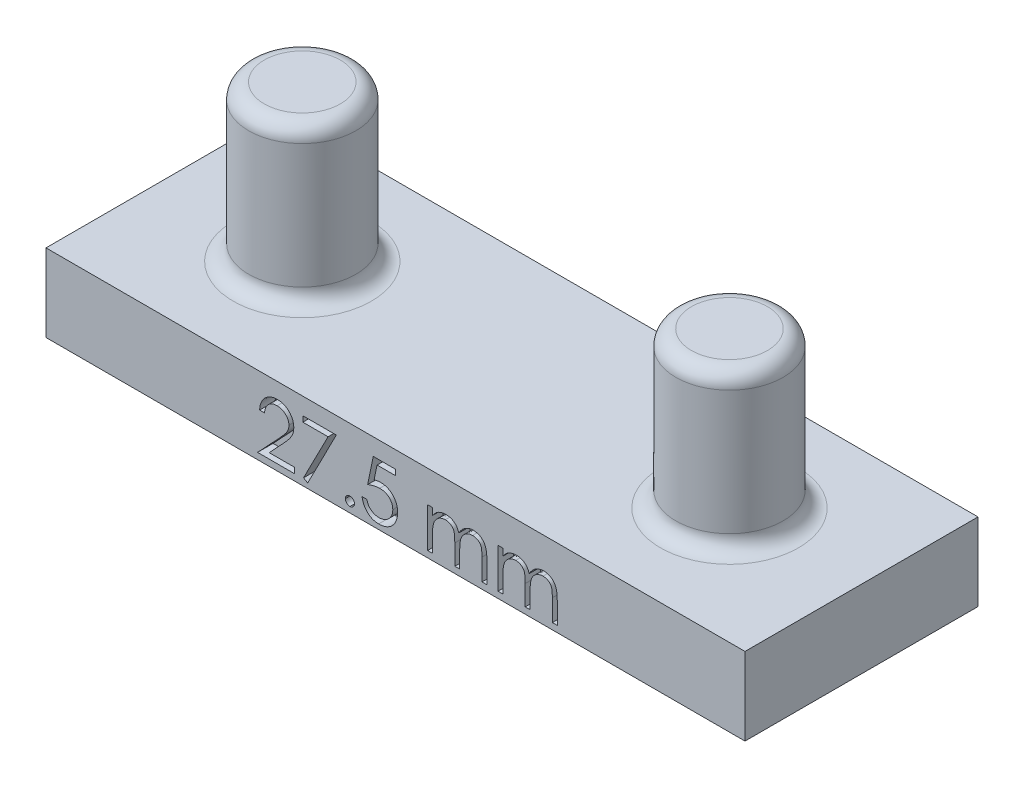
from build123d import *

# Parameters (mm, degrees)
SKETCH1_R             = 3.448679322
BOSS_EXTRUDE1_DEPTH   = 10
BOSS_EXTRUDE1_2_DEPTH = 10
SKETCH2_W             = 45
SKETCH2_H             = 15
BOSS_EXTRUDE2_DEPTH   = 5
CUT_EXTRUDE1_DEPTH    = 1
FILLET1_R             = 1


with BuildPart() as part:
    # Sketch1 → Boss-Extrude1 (new body)
    with BuildSketch(Plane(origin=(0, 0, 0), x_dir=(1, 0, 0), z_dir=(0, 1, 0))):
        with Locations((-41.821276596, 3.10212766)):
            Circle(SKETCH1_R)
    extrude(amount=BOSS_EXTRUDE1_DEPTH)



with BuildPart() as body_2:
    # Sketch1 → Boss-Extrude1 2 (new body)
    with BuildSketch(Plane(origin=(0, 0, 0), x_dir=(1, 0, 0), z_dir=(0, 1, 0))):
        with Locations((-14.321276596, 3.10212766)):
            Circle(SKETCH1_R)
    extrude(amount=BOSS_EXTRUDE1_2_DEPTH)


with BuildPart() as part_1:
    add(part.part)

    add(body_2.part)  # Boss-Extrude2 merges body 2
    # Sketch2 → Boss-Extrude2 (add)
    with BuildSketch(Plane.XZ):
        with Locations((-28.321276596, -3.10212766)):
            Rectangle(SKETCH2_W, SKETCH2_H)
    extrude(amount=BOSS_EXTRUDE2_DEPTH)

    # Sketch3 → Cut-Extrude1 (cut)
    with BuildSketch(Plane.XY.offset(4.39787234)):
        with BuildLine():
            Line((-21.721415096, -2.034062219), (-21.407312532, -2.034062219))
            Line((-21.407312532, -2.034062219), (-21.407312532, -2.478573436))
            add(Edge.make_bspline(
                [(-21.407312532, -2.478573436), (-21.379028582, -2.439685835), (-21.324833822, -2.365173462), (-21.23596817, -2.266983177), (-21.147192057, -2.183655023), (-21.083258676, -2.139912151), (-21.052544904, -2.118897956)],
                knots=[0, 0, 0, 0, 1.134379233, 2.173579362, 3.122582517, 4, 4, 4, 4], degree=3))
            add(Edge.make_bspline(
                [(-21.052544904, -2.118897956), (-21.010680241, -2.09889259), (-20.927682342, -2.059231377), (-20.796263117, -2.018997818), (-20.661788447, -1.994272717), (-20.570980233, -1.990891343), (-20.525301314, -1.989190424)],
                knots=[0, 0, 0, 0, 1.014936303, 2.012140481, 3.000054389, 4, 4, 4, 4], degree=3))
            add(Edge.make_bspline(
                [(-20.525301314, -1.989190424), (-20.494408317, -1.990235714), (-20.433272738, -1.992304289), (-20.342688648, -2.005764324), (-20.254830036, -2.029030497), (-20.170216007, -2.061437821), (-20.090495328, -2.100684508), (-20.01740613, -2.146734216), (-19.951781922, -2.198431291), (-19.893655871, -2.258110224), (-19.841386845, -2.327446823), (-19.793307998, -2.408311072), (-19.748882786, -2.502518733), (-19.724261477, -2.570885274), (-19.71129891, -2.606878725)],
                knots=[0, 0, 0, 0, 1.009824226, 1.998387844, 2.986035974, 3.974953746, 4.955485308, 5.885931332, 6.793869504, 7.679848016, 8.601185859, 9.625726857, 10.749998409, 12, 12, 12, 12], degree=3))
            add(Edge.make_bspline(
                [(-19.71129891, -2.606878725), (-19.697587659, -2.582154306), (-19.670605842, -2.533500121), (-19.625300205, -2.464641858), (-19.577832408, -2.400235067), (-19.527797915, -2.340228642), (-19.475373328, -2.284918912), (-19.420311928, -2.23412301), (-19.362927146, -2.187622797), (-19.283134906, -2.133299637), (-19.179322299, -2.075598456), (-19.048434184, -2.025570012), (-18.912284013, -1.994653883), (-18.819866315, -1.99102361), (-18.773197949, -1.989190424)],
                knots=[0, 0, 0, 0, 0.86119277, 1.694706429, 2.50939023, 3.298075842, 4.073795165, 4.829715201, 5.57930267, 6.321991688, 7.768977793, 9.186738141, 10.579381044, 12, 12, 12, 12], degree=3))
            add(Edge.make_bspline(
                [(-18.773197949, -1.989190424), (-18.730316486, -1.990807645), (-18.646393299, -1.993972703), (-18.524216034, -2.018826176), (-18.410274228, -2.061503823), (-18.304797152, -2.11973746), (-18.209637339, -2.192916643), (-18.12692103, -2.279985481), (-18.057150666, -2.380328104), (-18.011572027, -2.474720092), (-17.980656762, -2.558055425), (-17.961595528, -2.629061717), (-17.944755833, -2.707213269), (-17.930774588, -2.792603531), (-17.920556036, -2.885534139), (-17.91298532, -2.985853015), (-17.907861247, -3.093638127), (-17.907499174, -3.168003627), (-17.907312532, -3.20633786)],
                knots=[0, 0, 0, 0, 1.209669288, 2.367440248, 3.500751976, 4.631527125, 5.755587489, 6.87532382, 8.007944318, 9.190864318, 9.82315674, 10.514484317, 11.263564316, 12.079023757, 12.955305781, 13.901327259, 14.918167583, 16, 16, 16, 16], degree=3))
            Line((-17.907312532, -3.20633786), (-17.907312532, -4.591754526))
            Line((-17.907312532, -4.591754526), (-18.221415096, -4.591754526))
            Line((-18.221415096, -4.591754526), (-18.221415096, -3.204935616))
            add(Edge.make_bspline(
                [(-18.221415096, -3.204935616), (-18.221492979, -3.172215042), (-18.221642658, -3.109331075), (-18.22433629, -3.019078624), (-18.229411604, -2.936810267), (-18.235346243, -2.862638179), (-18.243590052, -2.79638939), (-18.254235984, -2.738196972), (-18.265513664, -2.68760316), (-18.284249655, -2.631517113), (-18.314197546, -2.569646902), (-18.359815026, -2.502923326), (-18.417285133, -2.444842526), (-18.483645289, -2.394424209), (-18.559193734, -2.353430568), (-18.642458457, -2.324154558), (-18.732922509, -2.30603168), (-18.795545297, -2.304225665), (-18.827885449, -2.303292988)],
                knots=[0, 0, 0, 0, 1.253487763, 2.409012846, 3.458416907, 4.410876679, 5.259312806, 6.014470957, 6.676830364, 7.243083969, 8.276244668, 9.299465089, 10.325150304, 11.392391894, 12.482080715, 13.603491619, 14.762376348, 16, 16, 16, 16], degree=3))
            add(Edge.make_bspline(
                [(-18.827885449, -2.303292988), (-18.867555403, -2.304709145), (-18.945958314, -2.307508011), (-19.0604038, -2.336081884), (-19.170374817, -2.379162134), (-19.27258995, -2.441594591), (-19.36661774, -2.516402955), (-19.447517318, -2.605352551), (-19.514349504, -2.705982478), (-19.55960348, -2.79912918), (-19.588192781, -2.882798624), (-19.607069697, -2.955895996), (-19.621753088, -3.038977564), (-19.635523617, -3.131485055), (-19.644511345, -3.234055235), (-19.652679718, -3.346213636), (-19.656500581, -3.468297596), (-19.657035039, -3.552924284), (-19.657312532, -3.596862699)],
                knots=[0, 0, 0, 0, 1.090531906, 2.155305635, 3.229839962, 4.33261226, 5.44038871, 6.529323825, 7.629011124, 8.757537029, 9.370236727, 10.061839251, 10.834451254, 11.692844982, 12.636905849, 13.66920014, 14.789842145, 16, 16, 16, 16], degree=3))
            Line((-19.657312532, -3.596862699), (-19.657312532, -4.591754526))
            Line((-19.657312532, -4.591754526), (-19.971415096, -4.591754526))
            Line((-19.971415096, -4.591754526), (-19.971415096, -3.291173597))
            add(Edge.make_bspline(
                [(-19.971415096, -3.291173597), (-19.971494527, -3.254480278), (-19.971647344, -3.183886021), (-19.974323661, -3.082652345), (-19.979410283, -2.990571265), (-19.985290832, -2.907749802), (-19.99375101, -2.834338473), (-20.003360772, -2.769943715), (-20.014709383, -2.714726964), (-20.033499267, -2.654163579), (-20.062213736, -2.587442656), (-20.108401998, -2.516301635), (-20.166009578, -2.454033537), (-20.233580454, -2.400874789), (-20.309586136, -2.356933307), (-20.393569537, -2.325273556), (-20.48477445, -2.306849266), (-20.547652156, -2.304500769), (-20.579988814, -2.303292988)],
                knots=[0, 0, 0, 0, 1.320475261, 2.540461679, 3.643808994, 4.639130445, 5.527981419, 6.302341397, 6.981980563, 7.553956391, 8.582137848, 9.585246428, 10.591171744, 11.620968678, 12.668337649, 13.738356861, 14.836885341, 16, 16, 16, 16], degree=3))
            add(Edge.make_bspline(
                [(-20.579988814, -2.303292988), (-20.618005025, -2.304823448), (-20.693769985, -2.3078736), (-20.805071954, -2.335327874), (-20.912557638, -2.378331949), (-21.014512337, -2.437991768), (-21.108186485, -2.511890847), (-21.190194752, -2.598805742), (-21.259137278, -2.697654776), (-21.304869093, -2.789819292), (-21.334367567, -2.871392567), (-21.353962902, -2.940743515), (-21.370802527, -3.017743763), (-21.383316549, -3.102630874), (-21.395396965, -3.194851968), (-21.401227274, -3.294866458), (-21.406898836, -3.402588546), (-21.407171251, -3.476961091), (-21.407312532, -3.515532571)],
                knots=[0, 0, 0, 0, 1.098833095, 2.189935336, 3.297829714, 4.440610912, 5.596351641, 6.740013378, 7.886572111, 9.072425424, 9.705826452, 10.395263256, 11.156850408, 11.985370555, 12.878090359, 13.847760091, 14.883794034, 16, 16, 16, 16], degree=3))
            Line((-21.407312532, -3.515532571), (-21.407312532, -4.591754526))
            Line((-21.407312532, -4.591754526), (-21.721415096, -4.591754526))
            Line((-21.721415096, -4.591754526), (-21.721415096, -2.034062219))
        make_face()
        with BuildLine():
            Line((-26.253466378, -2.034062219), (-25.939363814, -2.034062219))
            Line((-25.939363814, -2.034062219), (-25.939363814, -2.478573436))
            add(Edge.make_bspline(
                [(-25.939363814, -2.478573436), (-25.911079864, -2.439685835), (-25.856885104, -2.365173462), (-25.768019452, -2.266983177), (-25.679243339, -2.183655023), (-25.615309958, -2.139912151), (-25.584596186, -2.118897956)],
                knots=[0, 0, 0, 0, 1.134379233, 2.173579362, 3.122582517, 4, 4, 4, 4], degree=3))
            add(Edge.make_bspline(
                [(-25.584596186, -2.118897956), (-25.542731524, -2.09889259), (-25.459733624, -2.059231377), (-25.328314399, -2.018997818), (-25.193839729, -1.994272717), (-25.103031515, -1.990891343), (-25.057352596, -1.989190424)],
                knots=[0, 0, 0, 0, 1.014936303, 2.012140481, 3.000054389, 4, 4, 4, 4], degree=3))
            add(Edge.make_bspline(
                [(-25.057352596, -1.989190424), (-25.026459599, -1.990235714), (-24.96532402, -1.992304289), (-24.87473993, -2.005764324), (-24.786881318, -2.029030497), (-24.702267289, -2.061437821), (-24.62254661, -2.100684508), (-24.549457412, -2.146734216), (-24.483833204, -2.198431291), (-24.425707153, -2.258110224), (-24.373438127, -2.327446823), (-24.325359281, -2.408311072), (-24.280934068, -2.502518733), (-24.256312759, -2.570885274), (-24.243350192, -2.606878725)],
                knots=[0, 0, 0, 0, 1.009824226, 1.998387844, 2.986035974, 3.974953746, 4.955485308, 5.885931332, 6.793869504, 7.679848016, 8.601185859, 9.625726857, 10.749998409, 12, 12, 12, 12], degree=3))
            add(Edge.make_bspline(
                [(-24.243350192, -2.606878725), (-24.229638941, -2.582154306), (-24.202657124, -2.533500121), (-24.157351487, -2.464641858), (-24.10988369, -2.400235067), (-24.059849197, -2.340228642), (-24.00742461, -2.284918912), (-23.95236321, -2.23412301), (-23.894978428, -2.187622797), (-23.815186189, -2.133299637), (-23.711373581, -2.075598456), (-23.580485466, -2.025570012), (-23.444335295, -1.994653883), (-23.351917597, -1.99102361), (-23.305249231, -1.989190424)],
                knots=[0, 0, 0, 0, 0.86119277, 1.694706429, 2.50939023, 3.298075842, 4.073795165, 4.829715201, 5.57930267, 6.321991688, 7.768977793, 9.186738141, 10.579381044, 12, 12, 12, 12], degree=3))
            add(Edge.make_bspline(
                [(-23.305249231, -1.989190424), (-23.262367768, -1.990807645), (-23.178444581, -1.993972703), (-23.056267316, -2.018826176), (-22.94232551, -2.061503823), (-22.836848434, -2.11973746), (-22.741688621, -2.192916643), (-22.658972312, -2.279985481), (-22.589201948, -2.380328104), (-22.543623309, -2.474720092), (-22.512708044, -2.558055425), (-22.49364681, -2.629061717), (-22.476807115, -2.707213269), (-22.46282587, -2.792603531), (-22.452607318, -2.885534139), (-22.445036602, -2.985853015), (-22.439912529, -3.093638127), (-22.439550456, -3.168003627), (-22.439363814, -3.20633786)],
                knots=[0, 0, 0, 0, 1.209669288, 2.367440248, 3.500751976, 4.631527125, 5.755587489, 6.87532382, 8.007944318, 9.190864318, 9.82315674, 10.514484317, 11.263564316, 12.079023757, 12.955305781, 13.901327259, 14.918167583, 16, 16, 16, 16], degree=3))
            Line((-22.439363814, -3.20633786), (-22.439363814, -4.591754526))
            Line((-22.439363814, -4.591754526), (-22.753466378, -4.591754526))
            Line((-22.753466378, -4.591754526), (-22.753466378, -3.204935616))
            add(Edge.make_bspline(
                [(-22.753466378, -3.204935616), (-22.753544261, -3.172215042), (-22.75369394, -3.109331075), (-22.756387572, -3.019078624), (-22.761462886, -2.936810267), (-22.767397525, -2.862638179), (-22.775641334, -2.79638939), (-22.786287266, -2.738196972), (-22.797564946, -2.68760316), (-22.816300937, -2.631517113), (-22.846248828, -2.569646902), (-22.891866308, -2.502923326), (-22.949336415, -2.444842526), (-23.015696571, -2.394424209), (-23.091245016, -2.353430568), (-23.174509739, -2.324154558), (-23.264973791, -2.30603168), (-23.327596579, -2.304225665), (-23.359936731, -2.303292988)],
                knots=[0, 0, 0, 0, 1.253487763, 2.409012846, 3.458416907, 4.410876679, 5.259312806, 6.014470957, 6.676830364, 7.243083969, 8.276244668, 9.299465089, 10.325150304, 11.392391894, 12.482080715, 13.603491619, 14.762376348, 16, 16, 16, 16], degree=3))
            add(Edge.make_bspline(
                [(-23.359936731, -2.303292988), (-23.399606685, -2.304709145), (-23.478009596, -2.307508011), (-23.592455082, -2.336081884), (-23.702426099, -2.379162134), (-23.804641232, -2.441594591), (-23.898669022, -2.516402955), (-23.9795686, -2.605352551), (-24.046400786, -2.705982478), (-24.091654762, -2.79912918), (-24.120244063, -2.882798624), (-24.139120979, -2.955895996), (-24.15380437, -3.038977564), (-24.1675749, -3.131485055), (-24.176562628, -3.234055235), (-24.184731, -3.346213636), (-24.188551863, -3.468297596), (-24.189086321, -3.552924284), (-24.189363814, -3.596862699)],
                knots=[0, 0, 0, 0, 1.090531906, 2.155305635, 3.229839962, 4.33261226, 5.44038871, 6.529323825, 7.629011124, 8.757537029, 9.370236727, 10.061839251, 10.834451254, 11.692844982, 12.636905849, 13.66920014, 14.789842145, 16, 16, 16, 16], degree=3))
            Line((-24.189363814, -3.596862699), (-24.189363814, -4.591754526))
            Line((-24.189363814, -4.591754526), (-24.503466378, -4.591754526))
            Line((-24.503466378, -4.591754526), (-24.503466378, -3.291173597))
            add(Edge.make_bspline(
                [(-24.503466378, -3.291173597), (-24.503545809, -3.254480278), (-24.503698626, -3.183886021), (-24.506374944, -3.082652345), (-24.511461565, -2.990571265), (-24.517342114, -2.907749802), (-24.525802292, -2.834338473), (-24.535412054, -2.769943715), (-24.546760665, -2.714726964), (-24.565550549, -2.654163579), (-24.594265018, -2.587442656), (-24.64045328, -2.516301635), (-24.69806086, -2.454033537), (-24.765631736, -2.400874789), (-24.841637418, -2.356933307), (-24.925620819, -2.325273556), (-25.016825732, -2.306849266), (-25.079703438, -2.304500769), (-25.112040096, -2.303292988)],
                knots=[0, 0, 0, 0, 1.320475261, 2.540461679, 3.643808994, 4.639130445, 5.527981419, 6.302341397, 6.981980563, 7.553956391, 8.582137848, 9.585246428, 10.591171744, 11.620968678, 12.668337649, 13.738356861, 14.836885341, 16, 16, 16, 16], degree=3))
            add(Edge.make_bspline(
                [(-25.112040096, -2.303292988), (-25.150056307, -2.304823448), (-25.225821267, -2.3078736), (-25.337123236, -2.335327874), (-25.44460892, -2.378331949), (-25.546563619, -2.437991768), (-25.640237767, -2.511890847), (-25.722246034, -2.598805742), (-25.79118856, -2.697654776), (-25.836920375, -2.789819292), (-25.866418849, -2.871392567), (-25.886014184, -2.940743515), (-25.90285381, -3.017743763), (-25.915367831, -3.102630874), (-25.927448247, -3.194851968), (-25.933278556, -3.294866458), (-25.938950118, -3.402588546), (-25.939222533, -3.476961091), (-25.939363814, -3.515532571)],
                knots=[0, 0, 0, 0, 1.098833095, 2.189935336, 3.297829714, 4.440610912, 5.596351641, 6.740013378, 7.886572111, 9.072425424, 9.705826452, 10.395263256, 11.156850408, 11.985370555, 12.878090359, 13.847760091, 14.883794034, 16, 16, 16, 16], degree=3))
            Line((-25.939363814, -3.515532571), (-25.939363814, -4.591754526))
            Line((-25.939363814, -4.591754526), (-26.253466378, -4.591754526))
            Line((-26.253466378, -4.591754526), (-26.253466378, -2.034062219))
        make_face()
        with BuildLine():
            Line((-28.317568942, -1.091754526), (-28.317568942, -1.450728885))
            Line((-28.317568942, -1.450728885), (-29.50807375, -1.450728885))
            Line((-29.50807375, -1.450728885), (-29.696675513, -2.371301802))
            add(Edge.make_bspline(
                [(-29.696675513, -2.371301802), (-29.659619638, -2.36107153), (-29.587829742, -2.341251996), (-29.481869881, -2.319246226), (-29.381277678, -2.305980782), (-29.316002308, -2.304169471), (-29.284415897, -2.303292988)],
                knots=[0, 0, 0, 0, 1.100273476, 2.13160584, 3.095893838, 4, 4, 4, 4], degree=3))
            add(Edge.make_bspline(
                [(-29.284415897, -2.303292988), (-29.245332158, -2.304138923), (-29.16848376, -2.305802244), (-29.056044813, -2.321774094), (-28.94871192, -2.346914008), (-28.84670955, -2.38203453), (-28.749848999, -2.426944263), (-28.659021438, -2.483044204), (-28.572863525, -2.548577535), (-28.492920931, -2.623922547), (-28.420396623, -2.706844164), (-28.356630633, -2.796002035), (-28.302468043, -2.890529697), (-28.258907288, -2.991330306), (-28.224122953, -3.097289459), (-28.200970959, -3.209522042), (-28.18555425, -3.326970162), (-28.183831863, -3.407274732), (-28.182953557, -3.448224879)],
                knots=[0, 0, 0, 0, 1.052922333, 2.070308379, 3.05430497, 4.020497103, 4.973039431, 5.925935799, 6.892292201, 7.88610001, 8.88166317, 9.857072816, 10.836096531, 11.812156883, 12.81219415, 13.836441305, 14.89672472, 16, 16, 16, 16], degree=3))
            add(Edge.make_bspline(
                [(-28.182953557, -3.448224879), (-28.183618633, -3.476747099), (-28.184939795, -3.533406087), (-28.191658383, -3.617550287), (-28.204594099, -3.69991312), (-28.221961823, -3.780505512), (-28.244504241, -3.859174885), (-28.271793295, -3.936146412), (-28.305189323, -4.010941019), (-28.341820698, -4.084266414), (-28.383067176, -4.154464921), (-28.428845683, -4.220113908), (-28.477211174, -4.282198189), (-28.52925256, -4.340051922), (-28.585453555, -4.39329494), (-28.645133522, -4.442243222), (-28.707816241, -4.487724552), (-28.774471483, -4.527892747), (-28.843613966, -4.564855703), (-28.916242183, -4.595179241), (-28.990702884, -4.622289769), (-29.068067759, -4.643899296), (-29.148161572, -4.660831851), (-29.231116347, -4.672332452), (-29.316497018, -4.680708889), (-29.37437203, -4.681233246), (-29.403606602, -4.681498116)],
                knots=[0, 0, 0, 0, 1.056347294, 2.098418968, 3.122841568, 4.141288669, 5.149314143, 6.15115421, 7.162517403, 8.180376062, 9.185164535, 10.17417709, 11.141909838, 12.097768115, 13.052685741, 14.0056014, 14.954263652, 15.917497458, 16.885230207, 17.854509472, 18.828990115, 19.81800267, 20.826176721, 21.857883937, 22.917946725, 24, 24, 24, 24], degree=3))
            add(Edge.make_bspline(
                [(-29.403606602, -4.681498116), (-29.438480783, -4.680807278), (-29.507091614, -4.679448136), (-29.607612181, -4.665229651), (-29.704326787, -4.644865734), (-29.796456888, -4.614229464), (-29.884828151, -4.57584217), (-29.968250869, -4.527325998), (-30.048856645, -4.472346894), (-30.123368682, -4.407466541), (-30.192524795, -4.336550859), (-30.254431304, -4.259593218), (-30.309564881, -4.177863776), (-30.357042628, -4.090965622), (-30.397540649, -3.999127091), (-30.429355638, -3.90200409), (-30.455033993, -3.800104086), (-30.465897413, -3.729950576), (-30.471415096, -3.694318629)],
                knots=[0, 0, 0, 0, 1.0467383, 2.05933395, 3.04377827, 4.011590433, 4.970194871, 5.932262533, 6.905835911, 7.896367577, 8.894135286, 9.877477877, 10.858688626, 11.851381753, 12.8477658, 13.868841284, 14.917554742, 16, 16, 16, 16], degree=3))
            Line((-30.471415096, -3.694318629), (-30.157312532, -3.694318629))
            add(Edge.make_bspline(
                [(-30.157312532, -3.694318629), (-30.149583974, -3.727695081), (-30.134729258, -3.791846476), (-30.102123509, -3.881977817), (-30.062257634, -3.962297041), (-30.014853285, -4.033866624), (-29.958303255, -4.096275622), (-29.893773826, -4.151892684), (-29.821426103, -4.202067813), (-29.741032873, -4.24389058), (-29.656219794, -4.279559334), (-29.567452584, -4.303311028), (-29.477148237, -4.320011921), (-29.416069867, -4.321683682), (-29.385377436, -4.322523757)],
                knots=[0, 0, 0, 0, 1.136247022, 2.183929868, 3.172523383, 4.106158343, 5.02341133, 5.958108904, 6.928429099, 7.938127109, 8.96079061, 9.975095812, 10.982467395, 12, 12, 12, 12], degree=3))
            add(Edge.make_bspline(
                [(-29.385377436, -4.322523757), (-29.355418991, -4.321702979), (-29.296430569, -4.320086861), (-29.209619182, -4.307647849), (-29.125806308, -4.288490277), (-29.045818951, -4.259820422), (-28.968257412, -4.224975704), (-28.895083641, -4.180260628), (-28.824180764, -4.12880061), (-28.757752631, -4.06984398), (-28.696913182, -4.004874285), (-28.64315706, -3.935396892), (-28.598380147, -3.861280045), (-28.560646038, -3.783806892), (-28.531992739, -3.702128335), (-28.511551758, -3.61662716), (-28.499548699, -3.52709218), (-28.497897519, -3.46602287), (-28.497056122, -3.434903565)],
                knots=[0, 0, 0, 0, 1.027316725, 2.022795036, 3.002884548, 3.971462791, 4.93288096, 5.914575861, 6.907176829, 7.935150275, 8.956128384, 9.956726525, 10.942570165, 11.921478529, 12.907843606, 13.90538589, 14.932640048, 16, 16, 16, 16], degree=3))
            add(Edge.make_bspline(
                [(-28.497056122, -3.434903565), (-28.497714601, -3.406827813), (-28.499003481, -3.351873524), (-28.509534051, -3.271474318), (-28.527851024, -3.195401275), (-28.553274904, -3.123287041), (-28.585554411, -3.055063599), (-28.625000724, -2.990660539), (-28.672354122, -2.930926706), (-28.72644601, -2.875834152), (-28.785704051, -2.824989277), (-28.851147794, -2.781645191), (-28.92140772, -2.745181273), (-28.99563732, -2.713713275), (-29.075602218, -2.691112529), (-29.159718851, -2.674144644), (-29.248895559, -2.664329281), (-29.309866247, -2.662967393), (-29.341206763, -2.662267347)],
                knots=[0, 0, 0, 0, 1.045622112, 2.046656509, 3.013763289, 3.955457236, 4.890082067, 5.820317437, 6.762574623, 7.722996705, 8.69280354, 9.665887285, 10.63943826, 11.638615906, 12.663482002, 13.728887084, 14.832589034, 16, 16, 16, 16], degree=3))
            add(Edge.make_bspline(
                [(-29.341206763, -2.662267347), (-29.368335691, -2.662847938), (-29.424350047, -2.664046711), (-29.510272873, -2.672873208), (-29.600564596, -2.687112503), (-29.694879092, -2.70669875), (-29.7934996, -2.732329827), (-29.896218001, -2.763044327), (-30.003250267, -2.799766326), (-30.075367992, -2.82749854), (-30.112440737, -2.841754526)],
                knots=[0, 0, 0, 0, 0.817624296, 1.688186739, 2.600797293, 3.572016777, 4.590301741, 5.671205678, 6.80286297, 8, 8, 8, 8], degree=3))
            Line((-30.112440737, -2.841754526), (-29.753466378, -1.091754526))
            Line((-29.753466378, -1.091754526), (-28.317568942, -1.091754526))
        make_face()
        with BuildLine():
            add(Edge.make_bspline(
                [(-31.256671506, -4.053292988), (-31.237181294, -4.054451154), (-31.198973012, -4.056721605), (-31.143733883, -4.072298279), (-31.093739224, -4.099956939), (-31.049206979, -4.136819717), (-31.012500502, -4.181515381), (-30.98385615, -4.231111289), (-30.968415165, -4.286812882), (-30.966161253, -4.325242557), (-30.96500484, -4.344959654)],
                knots=[0, 0, 0, 0, 1.020151414, 1.999887582, 2.974338812, 3.990962822, 5.007586832, 5.987933904, 6.967670073, 8, 8, 8, 8], degree=3))
            add(Edge.make_bspline(
                [(-30.96500484, -4.344959654), (-30.96620044, -4.364202984), (-30.968558147, -4.402150548), (-30.983820756, -4.457432011), (-31.012718806, -4.507058915), (-31.048953799, -4.552361053), (-31.093750232, -4.589301924), (-31.143852079, -4.616725268), (-31.198843337, -4.633417248), (-31.23715966, -4.635543545), (-31.256671506, -4.636626321)],
                knots=[0, 0, 0, 0, 1.009421747, 1.99056486, 2.972319754, 3.999869655, 5.017953583, 5.993804169, 6.978383603, 8, 8, 8, 8], degree=3))
            add(Edge.make_bspline(
                [(-31.256671506, -4.636626321), (-31.276197412, -4.635582724), (-31.314317094, -4.633545349), (-31.369103089, -4.616382543), (-31.419510057, -4.589559082), (-31.464297769, -4.552292173), (-31.500836241, -4.507292029), (-31.528461623, -4.457090233), (-31.545051772, -4.402308796), (-31.547233645, -4.364234153), (-31.548338173, -4.344959654)],
                knots=[0, 0, 0, 0, 1.022052826, 1.995314843, 2.982371812, 4.00089066, 5.028879526, 6.005146991, 6.990147033, 8, 8, 8, 8], degree=3))
            add(Edge.make_bspline(
                [(-31.548338173, -4.344959654), (-31.547276074, -4.325210275), (-31.545202455, -4.286652035), (-31.528426795, -4.231452927), (-31.501050583, -4.181284488), (-31.464045188, -4.136887908), (-31.419520892, -4.099700605), (-31.369224687, -4.072635812), (-31.314185147, -4.0565954), (-31.276175208, -4.054412883), (-31.256671506, -4.053292988)],
                knots=[0, 0, 0, 0, 1.032775665, 2.016367738, 2.991239715, 4.008302682, 5.025365648, 6.011011707, 6.979408107, 8, 8, 8, 8], degree=3))
        make_face()
        Polygon((-34.28551766, -1.091754526), (-32.131671506, -1.091754526), (-33.971415096, -4.681498116), (-34.242749231, -4.532159174), (-32.663121827, -1.450728885), (-34.28551766, -1.450728885), align=None)
        with BuildLine():
            Line((-36.753466378, -2.168677603), (-37.067568942, -2.168677603))
            add(Edge.make_bspline(
                [(-37.067568942, -2.168677603), (-37.065521789, -2.127006715), (-37.061501235, -2.045166201), (-37.042672946, -1.925842294), (-37.015732069, -1.811787496), (-36.977640615, -1.703917582), (-36.930334337, -1.601278774), (-36.873604309, -1.504278759), (-36.806410459, -1.41328757), (-36.730203725, -1.329148727), (-36.647435086, -1.251961156), (-36.558129146, -1.185305913), (-36.464284119, -1.128988242), (-36.36618472, -1.081907), (-36.262724157, -1.046567154), (-36.154841299, -1.020345514), (-36.042062162, -1.004569169), (-35.96522214, -1.002873383), (-35.92614266, -1.002010936)],
                knots=[0, 0, 0, 0, 1.10065271, 2.161652631, 3.183658789, 4.190468796, 5.17591951, 6.163126047, 7.15150782, 8.156236427, 9.156009102, 10.134482811, 11.092018607, 12.041330605, 13.001268258, 13.972401359, 14.968799086, 16, 16, 16, 16], degree=3))
            add(Edge.make_bspline(
                [(-35.92614266, -1.002010936), (-35.887764586, -1.002909393), (-35.812353041, -1.004674828), (-35.702291027, -1.019835857), (-35.597513732, -1.043581449), (-35.498225966, -1.076896865), (-35.405219901, -1.121681292), (-35.317796857, -1.175478831), (-35.234916046, -1.237698662), (-35.160309262, -1.310952476), (-35.091801183, -1.38915486), (-35.032698928, -1.472642764), (-34.982085764, -1.55887205), (-34.939898085, -1.648500251), (-34.908841946, -1.74237128), (-34.885263738, -1.839118482), (-34.871936324, -1.939743293), (-34.8698909, -2.007849849), (-34.868850993, -2.04247568)],
                knots=[0, 0, 0, 0, 1.111607364, 2.184268762, 3.212621178, 4.221274766, 5.211760367, 6.196651075, 7.1921475, 8.207485113, 9.220403448, 10.201281604, 11.166441695, 12.114753415, 13.065576456, 14.026450734, 14.996634279, 16, 16, 16, 16], degree=3))
            add(Edge.make_bspline(
                [(-34.868850993, -2.04247568), (-34.870544256, -2.091223515), (-34.873901068, -2.187863728), (-34.902615444, -2.329878591), (-34.947461955, -2.46747201), (-35.001459312, -2.578209312), (-35.055931756, -2.667442806), (-35.105019264, -2.740911511), (-35.162484075, -2.820016979), (-35.229162573, -2.904494317), (-35.303675445, -2.995005222), (-35.386697608, -3.091495017), (-35.47882109, -3.192966787), (-35.543479591, -3.262272388), (-35.576984006, -3.298184815)],
                knots=[0, 0, 0, 0, 1.184426356, 2.348067706, 3.509069118, 4.696110526, 5.333549288, 6.050745305, 6.844228056, 7.710549037, 8.667450064, 9.695053472, 10.805634456, 12, 12, 12, 12], degree=3))
            Line((-35.576984006, -3.298184815), (-36.452685128, -4.232780167))
            Line((-36.452685128, -4.232780167), (-34.823979199, -4.232780167))
            Line((-34.823979199, -4.232780167), (-34.823979199, -4.591754526))
            Line((-34.823979199, -4.591754526), (-37.202184327, -4.591754526))
            Line((-37.202184327, -4.591754526), (-35.844812532, -3.143236898))
            add(Edge.make_bspline(
                [(-35.844812532, -3.143236898), (-35.811764645, -3.108738591), (-35.748286418, -3.042474405), (-35.658503841, -2.945731445), (-35.577864853, -2.855981904), (-35.50584746, -2.773395356), (-35.444013955, -2.696763788), (-35.389141723, -2.628569084), (-35.345176132, -2.565814634), (-35.297460736, -2.49307402), (-35.251246755, -2.404261703), (-35.211534399, -2.295728014), (-35.18731955, -2.184000761), (-35.184414715, -2.108498724), (-35.182953557, -2.070520552)],
                knots=[0, 0, 0, 0, 1.329631726, 2.553950428, 3.673215718, 4.687767853, 5.603093632, 6.413772471, 7.123043292, 7.734684054, 8.834405432, 9.900288307, 10.943827018, 12, 12, 12, 12], degree=3))
            add(Edge.make_bspline(
                [(-35.182953557, -2.070520552), (-35.1835893, -2.046639153), (-35.184842226, -1.999573503), (-35.195899923, -1.930567744), (-35.212610429, -1.86400293), (-35.236555687, -1.799674311), (-35.268162428, -1.738228659), (-35.306635807, -1.679591179), (-35.351025871, -1.622902214), (-35.40237714, -1.569748916), (-35.45878866, -1.52106771), (-35.51838291, -1.477943625), (-35.581433014, -1.441904514), (-35.647673136, -1.412361017), (-35.716918605, -1.389185636), (-35.789303351, -1.373127056), (-35.864627367, -1.363044572), (-35.916060862, -1.3616804), (-35.942268461, -1.360985295)],
                knots=[0, 0, 0, 0, 0.991446411, 1.95395049, 2.89581595, 3.838931463, 4.798493298, 5.75982156, 6.748411868, 7.785213223, 8.824556874, 9.840280684, 10.836137867, 11.835679398, 12.848801643, 13.863922112, 14.911575587, 16, 16, 16, 16], degree=3))
            add(Edge.make_bspline(
                [(-35.942268461, -1.360985295), (-35.969639294, -1.361700328), (-36.02339109, -1.363104533), (-36.102310123, -1.372927197), (-36.177595901, -1.389873037), (-36.249437804, -1.413049712), (-36.31795739, -1.442508261), (-36.382821434, -1.479200005), (-36.443884323, -1.522983498), (-36.501260846, -1.572624055), (-36.554124825, -1.627891656), (-36.600571701, -1.689501619), (-36.641155715, -1.756329034), (-36.676564949, -1.828193585), (-36.705320639, -1.905747365), (-36.727293789, -1.98871507), (-36.744680636, -2.076736451), (-36.750489157, -2.137521536), (-36.753466378, -2.168677603)],
                knots=[0, 0, 0, 0, 1.031018746, 2.02475058, 2.990194455, 3.934040569, 4.864654155, 5.795059489, 6.735614925, 7.690564532, 8.649604399, 9.611025574, 10.590972636, 11.591080095, 12.624614302, 13.701020113, 14.821632451, 16, 16, 16, 16], degree=3))
        make_face()
    extrude(amount=-CUT_EXTRUDE1_DEPTH, mode=Mode.SUBTRACT)

    # Fillet1
    fillet1_edges = [part_1.edges().sort_by_distance(p)[0] for p in [
        (-45.269955918, 0, -3.10212766),
        (-17.769955918, 0, -3.10212766),
        (-17.769955918, 10, -3.10212766),
        (-45.269955918, 10, -3.10212766),
    ]]
    fillet(fillet1_edges, radius=FILLET1_R)


solid = part_1.part
